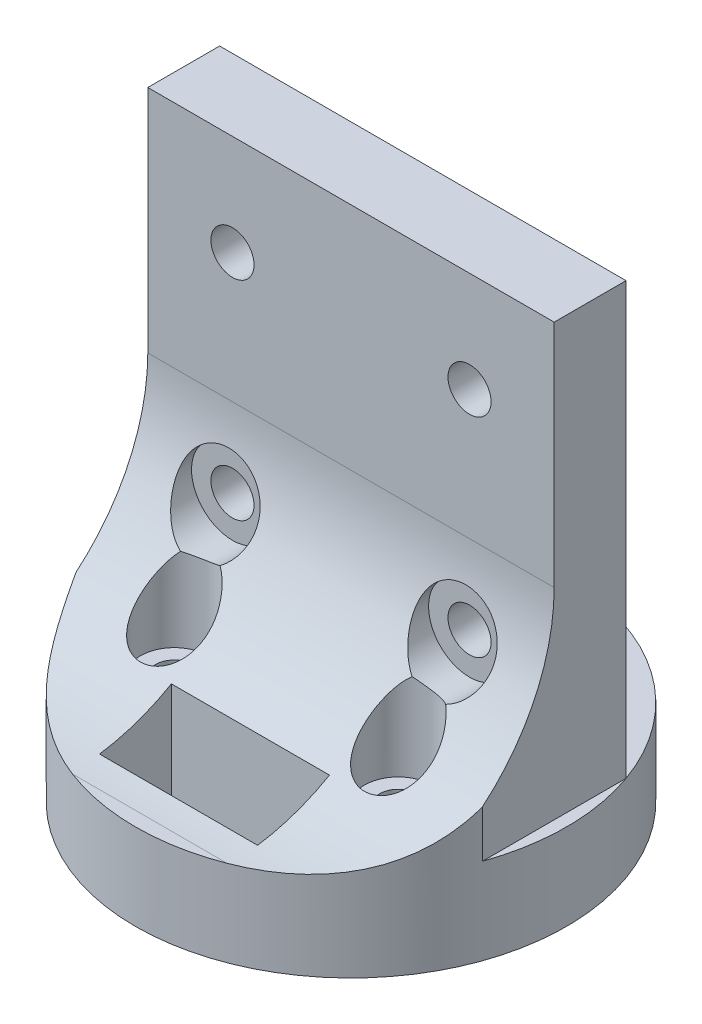
from build123d import *

# Parameters (mm, degrees)
SKETCH_1_R               = 15
SKETCH_1_R_2             = 1.3
SKETCH_1_W               = 11
SKETCH_1_H               = 5
EXTRUDE_1_DEPTH          = 6
SKETCH_2_W               = 28.284271248
SKETCH_2_H               = 5
EXTRUDE_2_DEPTH          = 30
CUT_EXTRUDE_1_DEPTH      = 44.829214002
CUT_EXTRUDE_1_DEPTH_BACK = 44.829214002
SKETCH_3_R               = 1.5
FILLET_2_R               = 14
SKETCH_4_R               = 2.35
CUT_EXTRUDE_2_DEPTH      = 37.742346223
SKETCH_5_R               = 2.85
CUT_EXTRUDE_3_DEPTH      = 42.785164903
SKETCH_6_R               = 0.75
CUT_EXTRUDE_4_DEPTH      = 1


with BuildPart() as part:
    # 草图1 → 凸台-拉伸1 (new body)
    with BuildSketch(Plane(origin=(0, 0, 0), x_dir=(1, 0, 0), z_dir=(0, 1, 0))):
        with Locations(Location((0, 0, 0), (0, 0, 270))):
            Circle(SKETCH_1_R)
        with Locations(Location((0, 9, 0), (0, 0, 270))):
            Circle(SKETCH_1_R_2, mode=Mode.SUBTRACT)
        with Locations(Location((7.794228634, -4.5, 0), (0, 0, 270))):
            Circle(SKETCH_1_R_2, mode=Mode.SUBTRACT)
        with Locations(Location((-7.794228634, -4.5, 0), (0, 0, 270))):
            Circle(SKETCH_1_R_2, mode=Mode.SUBTRACT)
        with Locations((0, -9.5)):
            Rectangle(SKETCH_1_W, SKETCH_1_H, mode=Mode.SUBTRACT)
    extrude(amount=EXTRUDE_1_DEPTH)

    # 草图2 → 凸台-拉伸2 (add)
    with BuildSketch(Plane(origin=(0, 6, 0), x_dir=(1, 0, 0), z_dir=(0, 1, 0))):
        with Locations((0, 2.5)):
            Rectangle(SKETCH_2_W, SKETCH_2_H)
    extrude(amount=EXTRUDE_2_DEPTH)

    # 草图3 → 切除-拉伸1 (cut, two sides: drawn at the far end of the back side and taken through both)
    with BuildSketch(Plane(origin=(0, 0, -5), x_dir=(-1, 0, 0), z_dir=(0, 0, -1)).offset(-CUT_EXTRUDE_1_DEPTH_BACK)):
        with Locations((-8.25, 14.5)):
            Circle(SKETCH_3_R)
        with Locations((8.25, 14.5)):
            Circle(SKETCH_3_R)
        with Locations((8.25, 29)):
            Circle(SKETCH_3_R)
        with Locations((-8.25, 29)):
            Circle(SKETCH_3_R)
    extrude(amount=CUT_EXTRUDE_1_DEPTH + CUT_EXTRUDE_1_DEPTH_BACK, mode=Mode.SUBTRACT)

    # 圆角2
    # the kernel refuses this fillet: 14 mm, written as the material it adds along each edge
    with BuildSketch(Plane(origin=(49.142135624, 6, 0), x_dir=(0, 0, 1), z_dir=(-1, 0, 0))) as fillet_2_piece_1_section:
        with BuildLine():
            CenterArc((FILLET_2_R, FILLET_2_R), FILLET_2_R, 180, 90)
            Line((0, FILLET_2_R), (0, 0))
            Line((0, 0), (FILLET_2_R, 0))
        make_face()
    fillet_2_piece_1 = extrude(amount=98.284271247, mode=Mode.PRIVATE)
    fillet_2_piece_1 = fillet_2_piece_1 & Plane(origin=(0, 6.047138864, 0), x_dir=(0, 0, 1), z_dir=(0, -1, 0)) * Cylinder(15, 253, mode=Mode.PRIVATE)
    fillet_2_piece_1 = split(fillet_2_piece_1, bisect_by=Plane(origin=(6.949412774, 6.047138864, 12), z_dir=(0, 0, 1)), keep=Keep.TOP, mode=Mode.PRIVATE)
    add(fillet_2_piece_1)
    with BuildSketch(Plane(origin=(14.142135624, 6, 0), x_dir=(0, 0, 1), z_dir=(-1, 0, 0))) as fillet_2_piece_2_section:
        with BuildLine():
            CenterArc((FILLET_2_R, FILLET_2_R), FILLET_2_R, 180, 90)
            Line((0, FILLET_2_R), (0, 0))
            Line((0, 0), (FILLET_2_R, 0))
        make_face()
    fillet_2_piece_2 = extrude(amount=63.284271247, mode=Mode.PRIVATE)
    fillet_2_piece_2 = fillet_2_piece_2 & Plane(origin=(0, 6.60039406, 0), x_dir=(0, 0, 1), z_dir=(0, -1, 0)) * Cylinder(15, 183, mode=Mode.PRIVATE)
    fillet_2_piece_2 = fillet_2_piece_2 - Plane(origin=(7.794228634, 6.60039406, 4.5), x_dir=(0, 0, 1), z_dir=(0, -1, 0)) * Cylinder(1.3, 183, mode=Mode.PRIVATE)
    fillet_2_piece_2 = split(fillet_2_piece_2, bisect_by=Plane(origin=(5.5, 6.60039406, 8.461968408), z_dir=(1, 0, 0)), keep=Keep.TOP, mode=Mode.PRIVATE)
    fillet_2_piece_2 = fillet_2_piece_2 - Plane(origin=(8.25, 14.5, 8.461968408), x_dir=(-1, 0, 0), z_dir=(0, 0, -1)) * Cylinder(1.5, 183, mode=Mode.PRIVATE)
    add(fillet_2_piece_2)
    with BuildSketch(Plane(origin=(49.142135624, 6, 0), x_dir=(0, 0, 1), z_dir=(-1, 0, 0))) as fillet_2_piece_3_section:
        with BuildLine():
            CenterArc((FILLET_2_R, FILLET_2_R), FILLET_2_R, 180, 90)
            Line((0, FILLET_2_R), (0, 0))
            Line((0, 0), (FILLET_2_R, 0))
        make_face()
    fillet_2_piece_3 = extrude(amount=63.284271247, mode=Mode.PRIVATE)
    fillet_2_piece_3 = fillet_2_piece_3 & Plane(origin=(0, 9.416347891, 0), x_dir=(0, 0, 1), z_dir=(0, -1, 0)) * Cylinder(15, 183, mode=Mode.PRIVATE)
    fillet_2_piece_3 = fillet_2_piece_3 - Plane(origin=(-7.794228634, 9.416347891, 4.5), x_dir=(0, 0, 1), z_dir=(0, -1, 0)) * Cylinder(1.3, 183, mode=Mode.PRIVATE)
    fillet_2_piece_3 = split(fillet_2_piece_3, bisect_by=Plane(origin=(0, 9.416347891, 7), z_dir=(0, 0, -1)), keep=Keep.TOP, mode=Mode.PRIVATE)
    fillet_2_piece_3 = split(fillet_2_piece_3, bisect_by=Plane(origin=(5.5, 9.416347891, 2.497543019), z_dir=(-1, 0, 0)), keep=Keep.TOP, mode=Mode.PRIVATE)
    fillet_2_piece_3 = fillet_2_piece_3 - Plane(origin=(-8.25, 14.5, 2.497543019), x_dir=(-1, 0, 0), z_dir=(0, 0, -1)) * Cylinder(1.5, 183, mode=Mode.PRIVATE)
    add(fillet_2_piece_3)
    with BuildSketch(Plane(origin=(49.142135624, 6, 0), x_dir=(0, 0, 1), z_dir=(-1, 0, 0))) as fillet_2_piece_4_section:
        with BuildLine():
            CenterArc((FILLET_2_R, FILLET_2_R), FILLET_2_R, 180, 90)
            Line((0, FILLET_2_R), (0, 0))
            Line((0, 0), (FILLET_2_R, 0))
        make_face()
    fillet_2_piece_4 = extrude(amount=98.284271247, mode=Mode.PRIVATE)
    fillet_2_piece_4 = fillet_2_piece_4 & Plane(origin=(0, 6.600394024, 0), x_dir=(0, 0, 1), z_dir=(0, -1, 0)) * Cylinder(15, 253, mode=Mode.PRIVATE)
    fillet_2_piece_4 = split(fillet_2_piece_4, bisect_by=Plane(origin=(-8.900767253, 6.600394024, 7), z_dir=(0, 0, 1)), keep=Keep.TOP, mode=Mode.PRIVATE)
    fillet_2_piece_4 = split(fillet_2_piece_4, bisect_by=Plane(origin=(-5.5, 6.600394024, 8.461968263), z_dir=(-1, 0, 0)), keep=Keep.TOP, mode=Mode.PRIVATE)
    add(fillet_2_piece_4)

    # 草图4 → 切除-拉伸2 (cut, through all)
    with BuildSketch(Plane(origin=(0, 6, 0), x_dir=(1, 0, 0), z_dir=(0, 1, 0))):
        with Locations((0, 9)):
            Circle(SKETCH_4_R)
        with Locations(Location((7.794228634, -4.5, 0), (0, 0, 90))):
            Circle(SKETCH_4_R)
        with Locations(Location((-7.794228634, -4.5, 0), (0, 0, 90))):
            Circle(SKETCH_4_R)
    extrude(amount=CUT_EXTRUDE_2_DEPTH, mode=Mode.SUBTRACT)

    # 草图5 → 切除-拉伸3 (cut, through all)
    with BuildSketch(Plane.XY):
        with Locations(Location((8.25, 14.5, 0), (0, 0, 236.662521272))):
            Circle(SKETCH_5_R)
        with Locations(Location((-8.25, 14.5, 0), (0, 0, 249.9708463))):
            Circle(SKETCH_5_R)
    extrude(amount=CUT_EXTRUDE_3_DEPTH, mode=Mode.SUBTRACT)

    # 草图6 → 切除-拉伸4 (cut)
    with BuildSketch(Plane(origin=(0, 0, -5), x_dir=(-1, 0, 0), z_dir=(0, 0, -1))):
        with Locations((-12.142135624, 34)):
            Circle(SKETCH_6_R)
    extrude(amount=-CUT_EXTRUDE_4_DEPTH, mode=Mode.SUBTRACT)


solid = part.part
